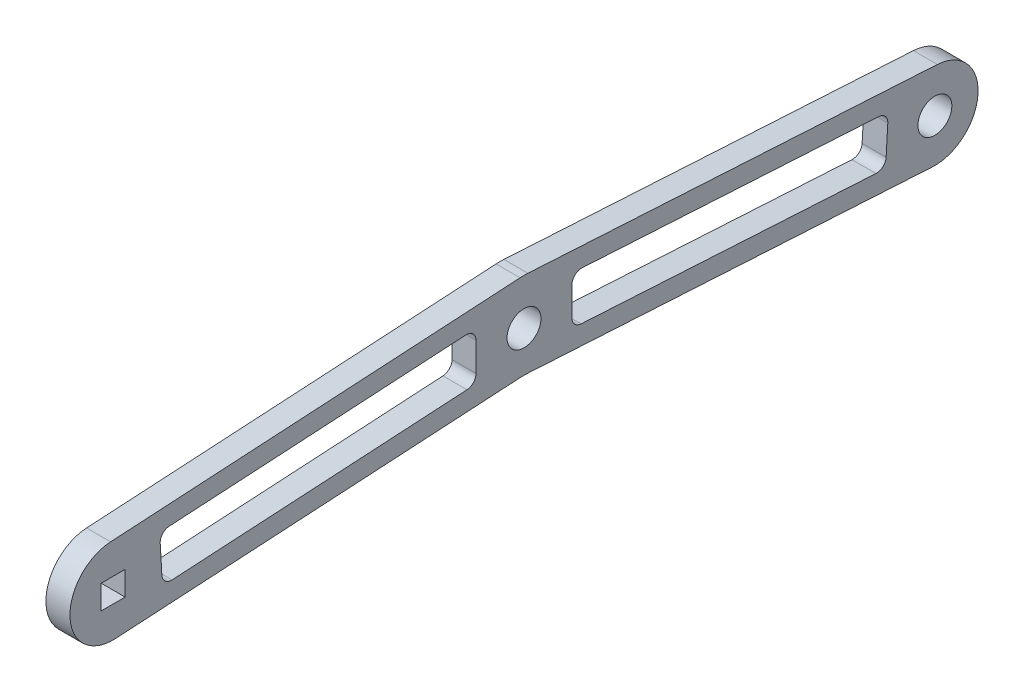
from build123d import *

# Parameters (mm, degrees)
SKETCH1_R           = 2.24506403
SKETCH1_W           = 3.175
SKETCH1_H           = 3.175
BOSS_EXTRUDE1_DEPTH = 3.175


with BuildPart() as part:
    # Sketch1 → Boss-Extrude1 (new body)
    with BuildSketch(Plane(origin=(0, 0, 0), x_dir=(0, 0, -1), z_dir=(1, 0, 0))):
        with BuildLine():
            Line((-109.045252071, 5.705275458), (-54.874392111, 8.869461204))
            ThreePointArc((-54.874392111, 8.869461204), (-54.356, 8.884588268), (-53.837607889, 8.869461204))
            Line((-53.837607889, 8.869461204), (0.333252071, 5.705275458))
            ThreePointArc((0.333252071, 5.705275458), (5.705275458, -0.333252071), (-0.333252071, -5.705275458))
            Line((-0.333252071, -5.705275458), (-53.837607889, -2.58002103))
            ThreePointArc((-53.837607889, -2.58002103), (-54.356, -2.564893965), (-54.874392111, -2.58002103))
            Line((-54.874392111, -2.58002103), (-108.378747929, -5.705275458))
            ThreePointArc((-108.378747929, -5.705275458), (-114.417275458, -0.333252071), (-109.045252071, 5.705275458))
        make_face()
        Circle(SKETCH1_R, mode=Mode.SUBTRACT)
        with Locations((-54.356, 2.829524238)):
            Circle(SKETCH1_R, mode=Mode.SUBTRACT)
        with Locations((-108.712, 0)):
            Rectangle(SKETCH1_W, SKETCH1_H, mode=Mode.SUBTRACT)
        with BuildLine():
            Line((-102.48388907, 2.272038565), (-102.261721022, -1.531478407))
            ThreePointArc((-102.261721022, -1.531478407), (-101.838014069, -2.40628545), (-100.919826016, -2.725261382))
            Line((-100.919826016, -2.725261382), (-61.901943984, -0.446179488))
            ThreePointArc((-61.901943984, -0.446179488), (-61.052162585, -0.049790111), (-60.706, 0.821659503))
            Line((-60.706, 0.821659503), (-60.706, 4.638153581))
            ThreePointArc((-60.706, 4.638153581), (-61.104550386, 5.561990996), (-62.050056016, 5.905992572))
            Line((-62.050056016, 5.905992572), (-101.290106095, 3.613933572))
            ThreePointArc((-101.290106095, 3.613933572), (-102.164913138, 3.190226618), (-102.48388907, 2.272038565))
        make_face(mode=Mode.SUBTRACT)
        with BuildLine():
            Line((-46.810056016, -0.446179488), (-7.792173984, -2.725261382))
            ThreePointArc((-7.792173984, -2.725261382), (-6.873985931, -2.40628545), (-6.450278978, -1.531478407))
            Line((-6.450278978, -1.531478407), (-6.22811093, 2.272038565))
            ThreePointArc((-6.22811093, 2.272038565), (-6.547086862, 3.190226618), (-7.421893905, 3.613933572))
            Line((-7.421893905, 3.613933572), (-46.661943984, 5.905992572))
            ThreePointArc((-46.661943984, 5.905992572), (-47.607449614, 5.561990996), (-48.006, 4.638153581))
            Line((-48.006, 4.638153581), (-48.006, 0.821659503))
            ThreePointArc((-48.006, 0.821659503), (-47.659837415, -0.049790111), (-46.810056016, -0.446179488))
        make_face(mode=Mode.SUBTRACT)
    extrude(amount=BOSS_EXTRUDE1_DEPTH)


solid = part.part
